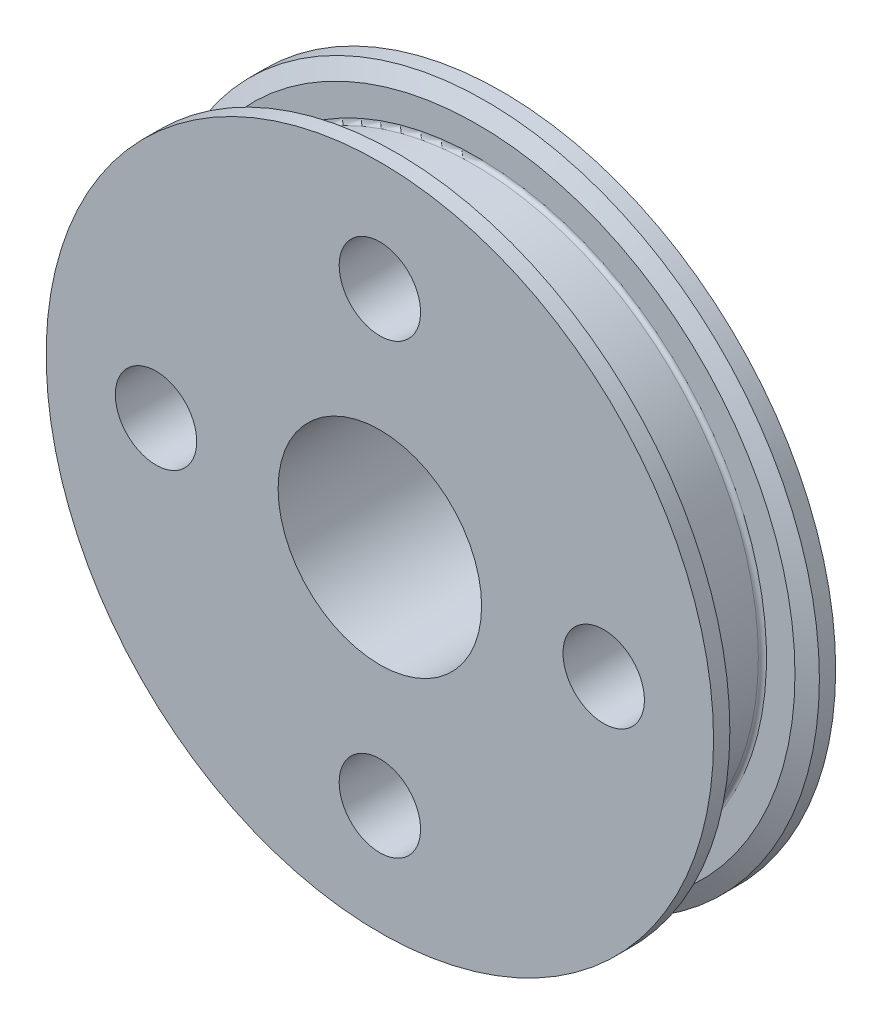
from build123d import *

# Parameters (mm, degrees)
SKETCH3_W           = 19.05
SKETCH3_H           = 19.05
SKETCH3_R           = 6.35
BOSS_EXTRUDE1_DEPTH = 3.175
SKETCH4_R           = 2.54
CUT_EXTRUDE1_DEPTH  = 31.424916894
FILLET1_R           = 0.254


with BuildPart() as part:
    # Sketch2 → Revolve1 (revolve)
    with BuildSketch(Plane(origin=(0, 0, 0), x_dir=(0, 0, -1), z_dir=(1, 0, 0))):
        Polygon((0, 6.35), (0, 20.828), (1.016, 20.828), (1.524, 19.812), (1.524, 17.78), (6.096, 17.78), (6.096, 19.812), (6.604, 20.828), (7.62, 20.828), (7.62, 6.35), align=None)
    revolve(axis=Axis((0, 0, 0), (0, 0, -1)))

    # Sketch3 → Boss-Extrude1 (add)
    with BuildSketch(Plane(origin=(0, 0, -7.62), x_dir=(-1, 0, 0), z_dir=(0, 0, -1))):
        Rectangle(SKETCH3_W, SKETCH3_H)
        Circle(SKETCH3_R, mode=Mode.SUBTRACT)
    extrude(amount=BOSS_EXTRUDE1_DEPTH)

    # Sketch4 → Cut-Extrude1 (cut, through all)
    with BuildSketch(Plane(origin=(0, 0, -7.62), x_dir=(-1, 0, 0), z_dir=(0, 0, -1))):
        with Locations((0, 13.97)):
            Circle(SKETCH4_R)
        with Locations((13.97, 0)):
            Circle(SKETCH4_R)
        with Locations((0, -13.97)):
            Circle(SKETCH4_R)
        with Locations((-13.97, 0)):
            Circle(SKETCH4_R)
    extrude(amount=-CUT_EXTRUDE1_DEPTH, mode=Mode.SUBTRACT)

    # Fillet1
    fillet1_edges = [part.edges().sort_by_distance(p)[0] for p in [
        (0, -17.78, -6.096),
        (0, -17.78, -1.524),
    ]]
    fillet(fillet1_edges, radius=FILLET1_R)


solid = part.part
